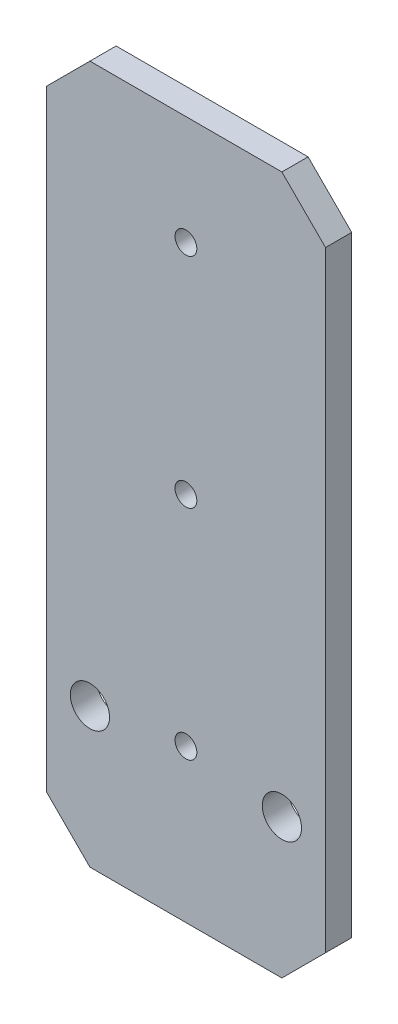
from build123d import *

# Parameters (mm, degrees)
ESQUISSE1_W                  = 32
ESQUISSE1_H                  = 80
BOSS_EXTRU_1_DEPTH           = 3
ENL_V_MAT_EXTRU_1_DEPTH      = 87.214847909
ENL_V_MAT_EXTRU_1_DEPTH_BACK = 87.214847909
ESQUISSE2_R                  = 1.25
ENL_V_MAT_EXTRU_2_DEPTH      = 87.214847909
ENL_V_MAT_EXTRU_2_DEPTH_BACK = 87.214847909
ESQUISSE3_R                  = 2.25
CHANFREIN1_SIZE              = 5


with BuildPart() as part:
    # Esquisse1 → Boss.-Extru.1 (new body)
    with BuildSketch(Plane.XY):
        with Locations((16, 40)):
            Rectangle(ESQUISSE1_W, ESQUISSE1_H)
    extrude(amount=BOSS_EXTRU_1_DEPTH)

    # Esquisse2 → Enlèv. mat.-Extru.1 (cut, two sides: drawn at the far end of the back side and taken through both)
    with BuildSketch(Plane.XY.offset(3).offset(-ENL_V_MAT_EXTRU_1_DEPTH_BACK)):
        with Locations((16, 17.5)):
            Circle(ESQUISSE2_R)
        with Locations((16, 42.5)):
            Circle(ESQUISSE2_R)
        with Locations((16, 67.5)):
            Circle(ESQUISSE2_R)
        with Locations((16, 92.5)):
            Circle(ESQUISSE2_R)
        with Locations((16, 117.5)):
            Circle(ESQUISSE2_R)
        with Locations((16, 142.5)):
            Circle(ESQUISSE2_R)
        with Locations((16, 167.5)):
            Circle(ESQUISSE2_R)
        with Locations((16, 192.5)):
            Circle(ESQUISSE2_R)
    extrude(amount=ENL_V_MAT_EXTRU_1_DEPTH + ENL_V_MAT_EXTRU_1_DEPTH_BACK, mode=Mode.SUBTRACT)

    # Esquisse3 → Enlèv. mat.-Extru.2 (cut, two sides: drawn at the far end of the back side and taken through both)
    with BuildSketch(Plane.XY.offset(3).offset(-ENL_V_MAT_EXTRU_2_DEPTH_BACK)):
        with Locations((5, 16)):
            Circle(ESQUISSE3_R)
        with Locations((27, 16)):
            Circle(ESQUISSE3_R)
    extrude(amount=ENL_V_MAT_EXTRU_2_DEPTH + ENL_V_MAT_EXTRU_2_DEPTH_BACK, mode=Mode.SUBTRACT)

    # Chanfrein1
    chanfrein1_edges = [part.edges().sort_by_distance(p)[0] for p in [
        (32, 0, 1.5),
        (0, 0, 1.5),
        (32, 80, 1.5),
        (0, 80, 1.5),
    ]]
    chamfer(chanfrein1_edges, length=CHANFREIN1_SIZE)


solid = part.part
